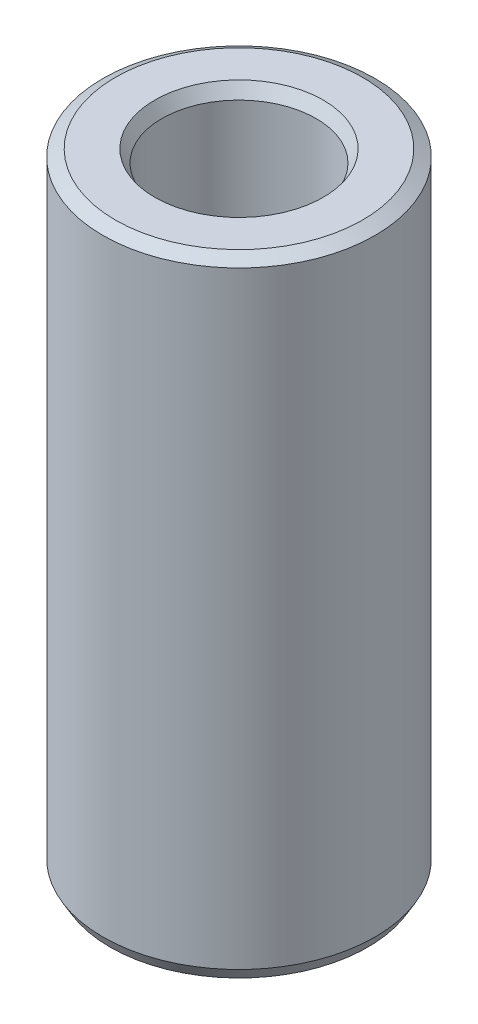
from build123d import *
from OCP.BRepFilletAPI import BRepFilletAPI_MakeChamfer

# Parameters (mm, degrees)
SKETCH1_R           = 15
BOSS_EXTRUDE1_DEPTH = 69.148263674
SKETCH2_R           = 8.502924995
CUT_EXTRUDE1_DEPTH  = 73.32898706
CHAMFER1_SIZE       = 0.789784705
CHAMFER1_SIZE2      = 1.367947236


with BuildPart() as part:
    # Sketch1 → Boss-Extrude1 (new body)
    with BuildSketch(Plane(origin=(0, 0, 0), x_dir=(1, 0, 0), z_dir=(0, 1, 0))):
        Circle(SKETCH1_R)
    extrude(amount=BOSS_EXTRUDE1_DEPTH)

    # Sketch2 → Cut-Extrude1 (cut, through all)
    with BuildSketch(Plane(origin=(0, 0, 0), x_dir=(1, 0, 0), z_dir=(0, 1, 0))):
        Circle(SKETCH2_R)
    extrude(amount=CUT_EXTRUDE1_DEPTH, mode=Mode.SUBTRACT)

    # Chamfer1: one chamfer whose edges measure the first distance from different faces: ONE call of the kernel's chamfer builder (chamfer() names one face for all edges)
    chamfer1_edges_1 = [part.edges().sort_by_distance(p)[0] for p in [
        (-8.502924995, 69.148263674, 0),
    ]]
    chamfer1_side_1 = [part.faces().sort_by_distance(p)[0] for p in [
        (-14.575735931, 69.148263674, 0),
    ]]
    chamfer1_edges_2 = [part.edges().sort_by_distance(p)[0] for p in [
        (-8.502924995, 0, 0),
    ]]
    chamfer1_side_2 = [part.faces().sort_by_distance(p)[0] for p in [
        (-8.502924995, 34.574131837, 0),
    ]]
    chamfer1_edges_3 = [part.edges().sort_by_distance(p)[0] for p in [
        (-15, 0, 0),
    ]]
    chamfer1_side_3 = [part.faces().sort_by_distance(p)[0] for p in [
        (-14.575735931, 0, 0),
    ]]
    chamfer1_edges_4 = [part.edges().sort_by_distance(p)[0] for p in [
        (-15, 69.148263674, 0),
    ]]
    chamfer1_side_4 = [part.faces().sort_by_distance(p)[0] for p in [
        (-15, 34.574131837, 0),
    ]]
    chamfer1 = BRepFilletAPI_MakeChamfer(part.part.solid().wrapped)
    for e in chamfer1_edges_1:
        chamfer1.Add(CHAMFER1_SIZE, CHAMFER1_SIZE2, e.wrapped, chamfer1_side_1[0].wrapped)  # the first distance lies on this face
    for e in chamfer1_edges_2:
        chamfer1.Add(CHAMFER1_SIZE, CHAMFER1_SIZE2, e.wrapped, chamfer1_side_2[0].wrapped)  # the first distance lies on this face
    for e in chamfer1_edges_3:
        chamfer1.Add(CHAMFER1_SIZE, CHAMFER1_SIZE2, e.wrapped, chamfer1_side_3[0].wrapped)  # the first distance lies on this face
    for e in chamfer1_edges_4:
        chamfer1.Add(CHAMFER1_SIZE, CHAMFER1_SIZE2, e.wrapped, chamfer1_side_4[0].wrapped)  # the first distance lies on this face
    add(Compound.cast(chamfer1.Shape()), mode=Mode.REPLACE)


solid = part.part
